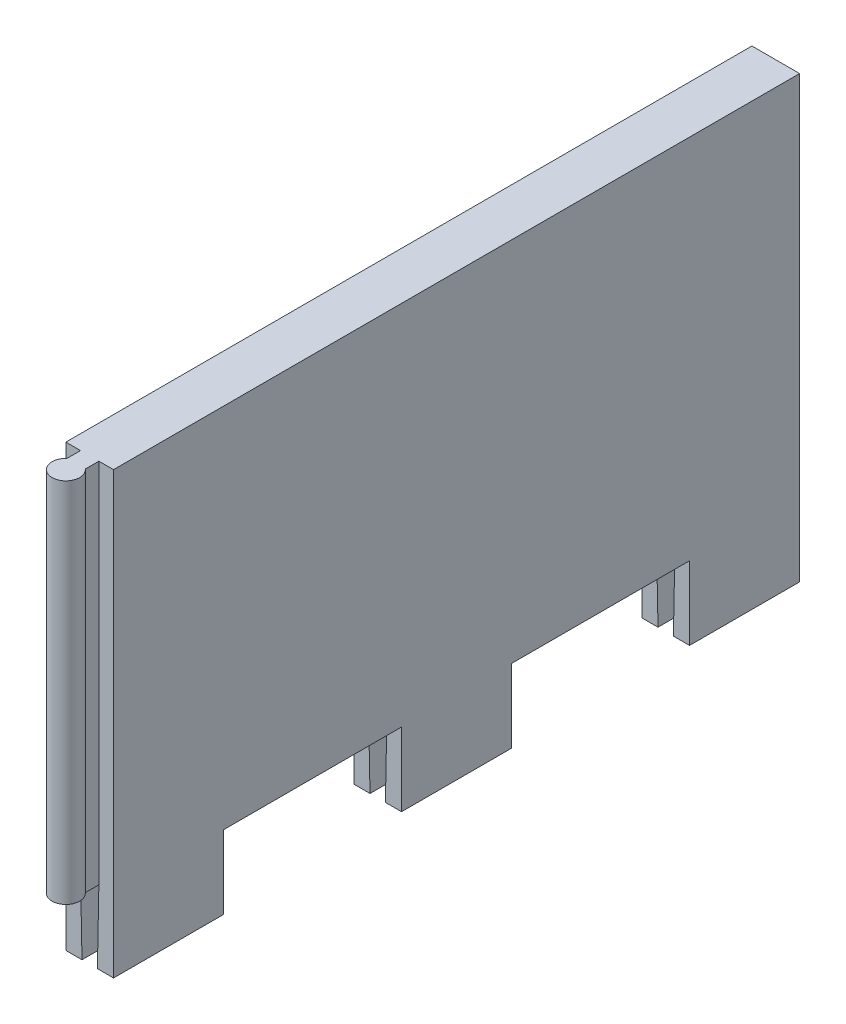
from build123d import *

# Parameters (mm, degrees)
BOSS_EXTRUDE1_DEPTH    = 76.2
CUT_EXTRUDE1_DEPTH     = 118.745
CUT_EXTRUDE2_START     = -12.7
CUT_EXTRUDE2_OUTLINE_W = 8.255
CUT_EXTRUDE2_OUTLINE_H = 30.7975
CUT_EXTRUDE2_DEPTH     = 12.7
SIDECUT_DEPTH          = 166.55395044


# Read off the part's stored shape, not the designer's step: Cut-Extrude2
with BuildPart() as part:
    # Sketch8 → Boss-Extrude1 (new body)
    with BuildSketch(Plane(origin=(0, 0, 0), x_dir=(1, 0, 0), z_dir=(0, 1, 0))):
        Polygon((-73.9775, 8.255), (-73.9775, 0), (73.9775, 0), (73.9775, 8.255), (69.215, 8.255), (69.215, 127), (60.96, 127), (60.96, 8.255), (-60.96, 8.255), (-60.96, 127), (-69.215, 127), (-69.215, 8.255), align=None)
    extrude(amount=BOSS_EXTRUDE1_DEPTH)

    # Sketch9 → Cut-Extrude1 (cut)
    with BuildSketch(Plane(origin=(0, 0, -127), x_dir=(-1, 0, 0), z_dir=(0, 0, -1))):
        Polygon((-66.421, 0), (-66.675, 12.697459746), (-63.5, 12.697459746), (-63.754, 0), align=None)
        Polygon((63.5, 12.697459746), (63.754, 0), (66.421, 0), (66.675, 12.697459746), align=None)
    extrude(amount=-CUT_EXTRUDE1_DEPTH, mode=Mode.SUBTRACT)

    # Cut-Extrude2 outline → Cut-Extrude2 (cut)
    with BuildSketch(Plane.XZ.offset(CUT_EXTRUDE2_START)):
        with Locations((65.0875, -42.70375)):
            Rectangle(CUT_EXTRUDE2_OUTLINE_W, CUT_EXTRUDE2_OUTLINE_H)
        with Locations((65.0875, -92.55125)):
            Rectangle(CUT_EXTRUDE2_OUTLINE_W, CUT_EXTRUDE2_OUTLINE_H)
        Polygon((62.9285, -8.255), (73.9775, -8.255), (73.9775, 0), (62.9285, 0), (62.9285, -2.54), (26.9875, -2.54), (26.9875, 0), (-26.9875, 0), (-26.9875, -2.54), (-62.9285, -2.54), (-62.9285, 0), (-73.9775, 0), (-73.9775, -8.255), (-62.9285, -8.255), (-62.9285, -5.715), (-26.9875, -5.715), (-26.9875, -8.255), (26.9875, -8.255), (26.9875, -5.715), (62.9285, -5.715), align=None)
        with Locations((-65.0875, -42.70375)):
            Rectangle(CUT_EXTRUDE2_OUTLINE_W, CUT_EXTRUDE2_OUTLINE_H)
        with Locations((-65.0875, -92.55125)):
            Rectangle(CUT_EXTRUDE2_OUTLINE_W, CUT_EXTRUDE2_OUTLINE_H)
    extrude(amount=CUT_EXTRUDE2_DEPTH, mode=Mode.SUBTRACT)

    # Sketch8<6> → SideCut (cut, through all)
    with BuildSketch(Plane(origin=(0, 0, 0), x_dir=(1, 0, 0), z_dir=(0, 1, 0))):
        with BuildLine():
            Line((-73.9775, 8.255), (-73.9775, 0))
            Line((-73.9775, 0), (73.9775, 0))
            Line((73.9775, 0), (73.9775, 8.255))
            Line((73.9775, 8.255), (69.215, 8.255))
            Line((69.215, 8.255), (69.215, 127))
            Line((69.215, 127), (60.96, 127))
            Line((60.96, 127), (60.96, 8.255))
            Line((60.96, 8.255), (-63.5, 8.255))
            Line((-63.5, 8.255), (-63.5, 5.902378957))
            ThreePointArc((-63.5, 5.902378957), (-65.0875, 1.74625), (-66.675, 5.902378957))
            Line((-66.675, 5.902378957), (-66.675, 8.255))
            Line((-66.675, 8.255), (-73.9775, 8.255))
        make_face()
    extrude(amount=SIDECUT_DEPTH, mode=Mode.SUBTRACT)


solid = part.part
